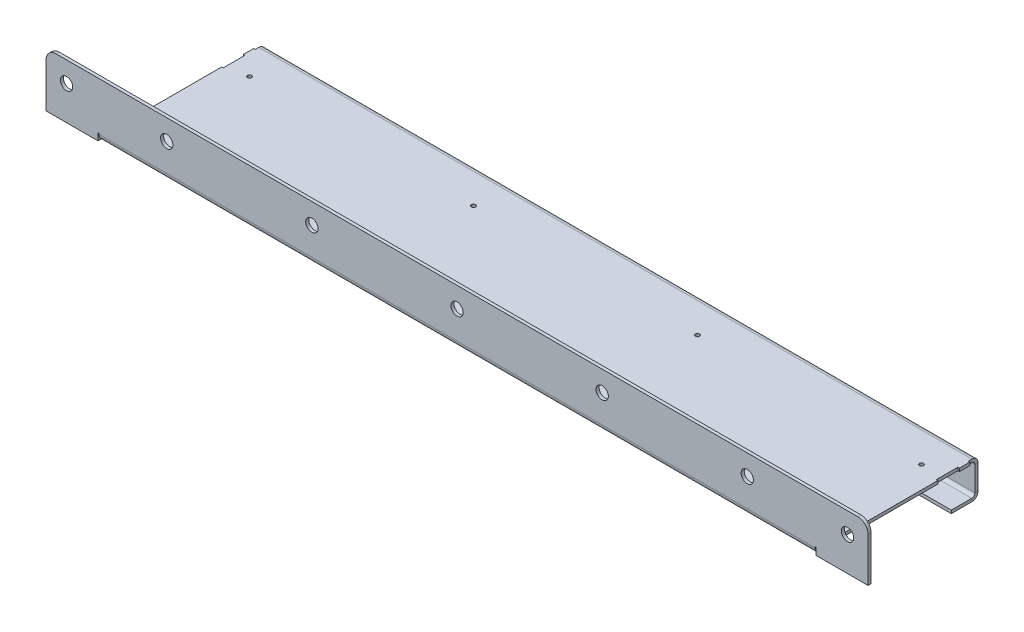
from build123d import *

# Parameters (mm, degrees)
SKETCH2_W                     = 800
SKETCH2_H                     = 53
BASE_FLANGE1_DEPTH            = 3
EDGE_FLANGE1_STRIP_W          = 18
EDGE_FLANGE1_STRIP_H          = 3
EDGE_FLANGE1_STRIP_CUT_DEPTH  = 697
EDGE_FLANGE1_RELIEF_W         = 18.9
EDGE_FLANGE1_RELIEF_H         = 0.9
EDGE_FLANGE1_RELIEF_CUT_DEPTH = 3
EDGE_FLANGE1_DEPTH            = 697
EDGE_FLANGE1_FLAT_DEPTH       = 3
EDGE_FLANGE2_STRIP_W          = 18
EDGE_FLANGE2_STRIP_H          = 3
EDGE_FLANGE2_STRIP_CUT_DEPTH  = 694
EDGE_FLANGE2_DEPTH            = 694
EDGE_FLANGE3_STRIP_W          = 18
EDGE_FLANGE3_STRIP_H          = 3
EDGE_FLANGE3_STRIP_CUT_DEPTH  = 694
EDGE_FLANGE3_DEPTH            = 694
FILLET1_R                     = 10
CUT_EXTRUDE2_DEPTH            = 3
LPATTERN1_COUNT               = 4
LPATTERN1_PITCH               = 195.333333333
SKETCH20_R                    = 6
CUT_EXTRUDE3_DEPTH            = 3
SKETCH21_R                    = 6
CUT_EXTRUDE4_DEPTH            = 3
LPATTERN2_COUNT               = 5
LPATTERN2_PITCH               = 141.25
SKETCH22_R                    = 2
CUT_EXTRUDE5_DEPTH            = 3
LPATTERN3_COUNT               = 4
LPATTERN3_PITCH               = 218


# Sheet-metal steps are written as plain solids
with BuildPart() as part:
    # Sketch2 → Base-Flange1 (new body)
    with BuildSketch(Plane.XY):
        Rectangle(SKETCH2_W, SKETCH2_H)
    extrude(amount=-BASE_FLANGE1_DEPTH)

    # Edge-Flange1 strip (across the edge) → Edge-Flange1 strip cut (cut)
    with BuildSketch(Plane(origin=(348.5, -26.5, -3), x_dir=(0, 1, 0), z_dir=(-1, 0, 0))):
        with Locations((-3, -1.5)):
            Rectangle(EDGE_FLANGE1_STRIP_W, EDGE_FLANGE1_STRIP_H)
    extrude(amount=EDGE_FLANGE1_STRIP_CUT_DEPTH, mode=Mode.SUBTRACT)

    # Edge-Flange1 relief (on the sheet) → Edge-Flange1 relief cut (cut)
    with BuildSketch(Plane(origin=(348.5, -20.5, -3), x_dir=(0, 1, 0), z_dir=(0, 0, -1))):
        with Locations((-8.55, 0.45)):
            Rectangle(EDGE_FLANGE1_RELIEF_W, EDGE_FLANGE1_RELIEF_H)
        with Locations((-8.55, -697.45)):
            Rectangle(EDGE_FLANGE1_RELIEF_W, EDGE_FLANGE1_RELIEF_H)
    extrude(amount=-EDGE_FLANGE1_RELIEF_CUT_DEPTH, mode=Mode.SUBTRACT)

    # Edge-Flange1 bend section (across the edge) → Edge-Flange1 (add)
    with BuildSketch(Plane(origin=(348.5, -26.5, -3), x_dir=(0, 1, 0), z_dir=(-1, 0, 0))):
        with BuildLine():
            Line((0, 3), (3, 3))
            ThreePointArc((3, 3), (3.878679656, 0.878679656), (6, 0))
            Line((6, 0), (6, -3))
            ThreePointArc((6, -3), (1.757359313, -1.242640687), (0, 3))
        make_face()
    extrude(amount=EDGE_FLANGE1_DEPTH)

    # Edge-Flange1 profile (on flange) → Edge-Flange1 flat (add)
    with BuildSketch(Plane(origin=(0, -26.5, -3), x_dir=(1, 0, 0), z_dir=(0, 1, 0))):
        Polygon((-348.5, 16.5), (-348.5, 3), (348.5, 3), (348.5, 16.5), (347, 16.5), (347, 37.5), (348.5, 37.5), (348.5, 116.5), (347, 116.5), (347, 137.5), (348.5, 137.5), (348.5, 147.5), (347, 147.5), (347, 157), (-347, 157), (-347, 147.5), (-348.5, 147.5), (-348.5, 137.5), (-347, 137.5), (-347, 116.5), (-348.5, 116.5), (-348.5, 37.5), (-347, 37.5), (-347, 16.5), align=None)
    extrude(amount=EDGE_FLANGE1_FLAT_DEPTH)

    # Edge-Flange2 strip (across the edge) → Edge-Flange2 strip cut (cut)
    with BuildSketch(Plane(origin=(-347, -26.5, -160), x_dir=(0, 0, 1), z_dir=(1, 0, 0))):
        with Locations((-3, -1.5)):
            Rectangle(EDGE_FLANGE2_STRIP_W, EDGE_FLANGE2_STRIP_H)
    extrude(amount=EDGE_FLANGE2_STRIP_CUT_DEPTH, mode=Mode.SUBTRACT)

    # Edge-Flange2 section (across the edge) → Edge-Flange2 (add)
    with BuildSketch(Plane(origin=(-347, -26.5, -160), x_dir=(0, 0, 1), z_dir=(1, 0, 0))):
        with BuildLine():
            Line((0, 3), (0, 33))
            Line((0, 33), (3, 33))
            Line((3, 33), (3, 3))
            ThreePointArc((3, 3), (3.878679656, 0.878679656), (6, 0))
            Line((6, 0), (6, -3))
            ThreePointArc((6, -3), (1.757359313, -1.242640687), (0, 3))
        make_face()
    extrude(amount=EDGE_FLANGE2_DEPTH)

    # Edge-Flange3 strip (across the edge) → Edge-Flange3 strip cut (cut)
    with BuildSketch(Plane(origin=(-347, -59.5, -157), x_dir=(0, 1, 0), z_dir=(1, 0, 0))):
        with Locations((-3, -1.5)):
            Rectangle(EDGE_FLANGE3_STRIP_W, EDGE_FLANGE3_STRIP_H)
    extrude(amount=EDGE_FLANGE3_STRIP_CUT_DEPTH, mode=Mode.SUBTRACT)

    # Edge-Flange3 section (across the edge) → Edge-Flange3 (add)
    with BuildSketch(Plane(origin=(-347, -59.5, -157), x_dir=(0, 1, 0), z_dir=(1, 0, 0))):
        with BuildLine():
            Line((0, 3), (0, 23))
            Line((0, 23), (3, 23))
            Line((3, 23), (3, 3))
            ThreePointArc((3, 3), (3.878679656, 0.878679656), (6, 0))
            Line((6, 0), (6, -3))
            ThreePointArc((6, -3), (1.757359313, -1.242640687), (0, 3))
        make_face()
    extrude(amount=EDGE_FLANGE3_DEPTH)

    # Fillet1
    fillet1_edges = [part.edges().sort_by_distance(p)[0] for p in [
        (-400, 26.5, -1.5),
        (400, 26.5, -1.5),
    ]]
    fillet(fillet1_edges, radius=FILLET1_R)

    # Sketch19 → Cut-Extrude2 (cut)
    with BuildSketch(Plane(origin=(0, 0, -160), x_dir=(-1, 0, 0), z_dir=(0, 0, -1))):
        Polygon((-286.591412012, -39.5), (-289.795706006, -33.95), (-296.204293994, -33.95), (-299.408587988, -39.5), (-296.204293994, -45.05), (-289.795706006, -45.05), align=None)
    cut_extrude2 = extrude(amount=-CUT_EXTRUDE2_DEPTH, mode=Mode.SUBTRACT)

    # LPattern1: Cut-Extrude2 ×4
    with Locations(*[(-i * LPATTERN1_PITCH, 0, 0) for i in range(1, LPATTERN1_COUNT)]):
        add(cut_extrude2, mode=Mode.SUBTRACT)

    # Sketch20 → Cut-Extrude3 (cut)
    with BuildSketch(Plane(origin=(0, 0, -3), x_dir=(-1, 0, 0), z_dir=(0, 0, -1))):
        with Locations((-380, 6.5)):
            Circle(SKETCH20_R)
        with Locations((380, 6.5)):
            Circle(SKETCH20_R)
    extrude(amount=-CUT_EXTRUDE3_DEPTH, mode=Mode.SUBTRACT)

    # Sketch21 → Cut-Extrude4 (cut)
    with BuildSketch(Plane(origin=(0, 0, -3), x_dir=(-1, 0, 0), z_dir=(0, 0, -1))):
        with Locations((-282.5, 6.5)):
            Circle(SKETCH21_R)
    cut_extrude4 = extrude(amount=-CUT_EXTRUDE4_DEPTH, mode=Mode.SUBTRACT)

    # LPattern2: Cut-Extrude4 ×5
    with Locations(*[(-i * LPATTERN2_PITCH, 0, 0) for i in range(1, LPATTERN2_COUNT)]):
        add(cut_extrude4, mode=Mode.SUBTRACT)

    # Sketch22 → Cut-Extrude5 (cut)
    with BuildSketch(Plane(origin=(0, -23.5, 0), x_dir=(1, 0, 0), z_dir=(0, 1, 0))):
        with Locations(Location((-327, 16, 0), (0, 0, 270))):
            Circle(SKETCH22_R)
        with Locations(Location((-327, 39, 0), (0, 0, 270))):
            Circle(SKETCH22_R)
        with Locations(Location((-327, 125, 0), (0, 0, 270))):
            Circle(SKETCH22_R)
    cut_extrude5 = extrude(amount=-CUT_EXTRUDE5_DEPTH, mode=Mode.SUBTRACT)

    # LPattern3: Cut-Extrude5 ×4
    with Locations(*[(i * LPATTERN3_PITCH, 0, 0) for i in range(1, LPATTERN3_COUNT)]):
        add(cut_extrude5, mode=Mode.SUBTRACT)


solid = part.part
